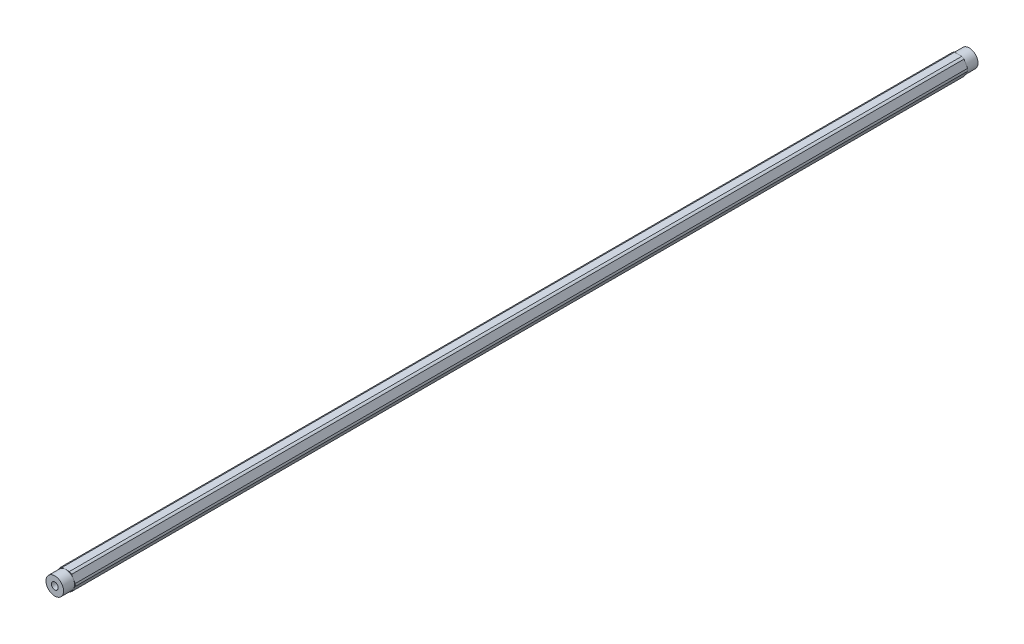
from build123d import *

# Parameters (mm, degrees)
BOSS_EXTRUDE1_DEPTH = 330.2
SKETCH3_OUTSIDE_W   = 148.8
SKETCH3_OUTSIDE_H   = 146.836
SKETCH3_OUTSIDE_R   = 6.35
CUT_EXTRUDE2_DEPTH  = 7.9502
SKETCH4_OUTSIDE_W   = 148.8
SKETCH4_OUTSIDE_H   = 146.836
SKETCH4_OUTSIDE_R   = 6.858
CUT_EXTRUDE3_DEPTH  = 661.471230133
SKETCH5_R           = 2.4892
CUT_EXTRUDE4_DEPTH  = 661.466134381


with BuildPart() as part:
    # Sketch1 → Boss-Extrude1 (new, symmetric)
    with BuildSketch(Plane.XY):
        Polygon((7.332348419, 0), (3.666174209, 6.35), (-3.666174209, 6.35), (-7.332348419, 0), (-3.666174209, -6.35), (3.666174209, -6.35), align=None)
    extrude(amount=BOSS_EXTRUDE1_DEPTH, both=True)

    # Sketch3 outside → Cut-Extrude2 (cut)
    with BuildSketch(Plane.XY.offset(330.2)):
        Rectangle(SKETCH3_OUTSIDE_W, SKETCH3_OUTSIDE_H)
        Circle(SKETCH3_OUTSIDE_R, mode=Mode.SUBTRACT)
    cut_extrude2 = extrude(amount=-CUT_EXTRUDE2_DEPTH, mode=Mode.SUBTRACT)

    # Mirror1: Cut-Extrude2 across plane
    add(cut_extrude2.mirror(Plane.XY), mode=Mode.SUBTRACT)

    # Sketch4 outside → Cut-Extrude3 (cut, through all)
    with BuildSketch(Plane.XY.offset(330.2)):
        Rectangle(SKETCH4_OUTSIDE_W, SKETCH4_OUTSIDE_H)
        Circle(SKETCH4_OUTSIDE_R, mode=Mode.SUBTRACT)
    extrude(amount=-CUT_EXTRUDE3_DEPTH, mode=Mode.SUBTRACT)

    # Sketch5 → Cut-Extrude4 (cut, through all)
    with BuildSketch(Plane.XY.offset(330.2)):
        Circle(SKETCH5_R)
    extrude(amount=-CUT_EXTRUDE4_DEPTH, mode=Mode.SUBTRACT)


solid = part.part
